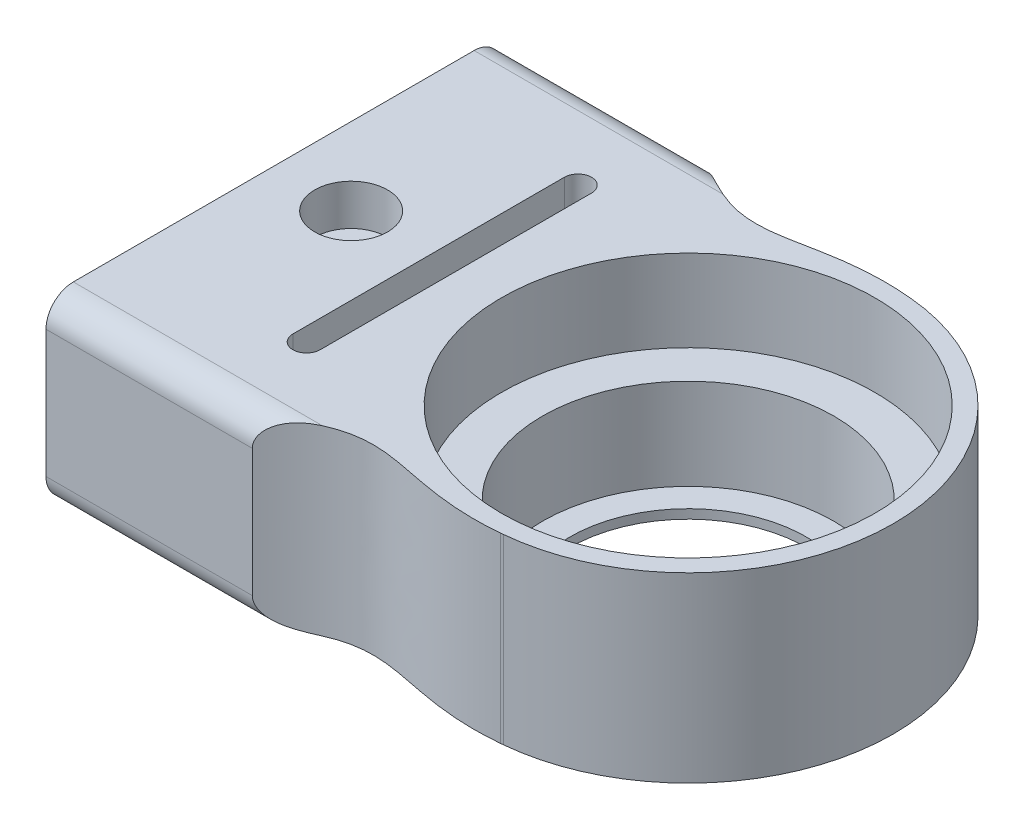
from build123d import *

# Parameters (mm, degrees)
EXTRUDE_1_DEPTH             = 20
SKETCH_2_R                  = 7
CUT_EXTRUDE_1_DEPTH         = 20
SKETCH_3_R                  = 13
CUT_EXTRUDE_2_DEPTH         = 87.740993769
SKETCH_4_R                  = 16
CUT_EXTRUDE_3_DEPTH         = 19
CUT_EXTRUDE_9_DEPTH         = 87.740993769
EXTRUDE_START               = -20
EXTRUDE_4_DEPTH             = 20
FILLET_2_R                  = 3
SKETCH_7_R                  = 20.5
CUT_EXTRUDE_10_DEPTH        = 9
SKETCH_8_W                  = 29.8
SKETCH_8_H                  = 4
CUT_EXTRUDE_11_DEPTH        = 20
CUT_EXTRUDE_12_DEPTH        = 10
HOLE_WIZARD_M41_D           = 4.3
HOLE_WIZARD_M41_DEPTH       = 8
HOLE_WIZARD_M41_CBORE_D     = 8
HOLE_WIZARD_M41_CBORE_DEPTH = 4.5
M4X0_71_D                   = 3.3


# Read off the part's stored shape, not the designer's step: Бобышка-Вытянуть4
with BuildPart() as part:
    # Эскиз1 → Бобышка-Вытянуть1 (new body)
    with BuildSketch(Plane(origin=(0, 0, 0), x_dir=(1, 0, 0), z_dir=(0, 1, 0))):
        with BuildLine():
            Line((0, 0), (0, 50))
            Line((0, 50), (20, 50))
            Line((20, 50), (47.60878471, 47.400960405))
            ThreePointArc((47.60878471, 47.400960405), (68, 25), (47.60878471, 2.599039595))
            Line((47.60878471, 2.599039595), (20, 0))
            Line((20, 0), (0, 0))
        make_face()
    extrude(amount=EXTRUDE_1_DEPTH)

    # Эскиз2 → Вырез-Вытянуть1 (cut)
    with BuildSketch(Plane.ZY):
        with Locations((-39.9, 10)):
            Circle(SKETCH_2_R)
        with Locations(Location((-10.1, 10, 0), (0, 0, 180))):
            Circle(SKETCH_2_R)
    extrude(amount=-CUT_EXTRUDE_1_DEPTH, mode=Mode.SUBTRACT)

    # Эскиз3 → Вырез-Вытянуть2 (cut, through all)
    with BuildSketch(Plane(origin=(0, 20, 0), x_dir=(1, 0, 0), z_dir=(0, 1, 0))):
        with Locations(Location((45.5, 25, 0), (0, 0, 270))):
            Circle(SKETCH_3_R)
    extrude(amount=-CUT_EXTRUDE_2_DEPTH, mode=Mode.SUBTRACT)

    # Эскиз4 → Вырез-Вытянуть3 (cut)
    with BuildSketch(Plane(origin=(0, 20, 0), x_dir=(1, 0, 0), z_dir=(0, 1, 0))):
        with Locations(Location((45.5, 25, 0), (0, 0, 270))):
            Circle(SKETCH_4_R)
    extrude(amount=-CUT_EXTRUDE_3_DEPTH, mode=Mode.SUBTRACT)

    # Эскиз5 → Вырез-Вытянуть9 (cut, through all)
    with BuildSketch(Plane(origin=(0, 20, 0), x_dir=(1, 0, 0), z_dir=(0, 1, 0))):
        with BuildLine():
            add(Edge.make_bspline(
                [(47.32108314, 47.428044097), (47.41641101, 47.41948544), (47.512308925, 47.410461109), (47.60878471, 47.400960405)],
                knots=[0.992066387, 0.992066387, 0.992066387, 0.992066387, 1, 1, 1, 1], degree=3))
            Line((47.32108314, 47.428044095), (47.60878471, 47.400960405))
        make_face()
        with BuildLine():
            Line((47.32108314, 47.428044097), (23, 49.717585585))
            add(Edge.make_bspline(
                [(23, 49.717585585), (32.393861284, 42.286998451), (35.400716473, 48.498269788), (47.32108314, 47.428044097)],
                knots=[0, 0, 0, 0, 0.992066387, 0.992066387, 0.992066387, 0.992066387], degree=3))
        make_face()
        with BuildLine():
            add(Edge.make_bspline(
                [(23, 0.282414415), (32.393861284, 7.713001549), (35.400716473, 1.501730212), (47.32108314, 2.571955903)],
                knots=[0, 0, 0, 0, 0.992066387, 0.992066387, 0.992066387, 0.992066387], degree=3))
            Line((23, 0.282414415), (47.32108314, 2.571955903))
        make_face()
        with BuildLine():
            Line((47.60878471, 2.599039595), (47.32108314, 2.571955905))
            add(Edge.make_bspline(
                [(47.32108314, 2.571955903), (47.41641101, 2.58051456), (47.512308925, 2.589538891), (47.60878471, 2.599039595)],
                knots=[0.992066387, 0.992066387, 0.992066387, 0.992066387, 1, 1, 1, 1], degree=3))
        make_face()
    extrude(amount=-CUT_EXTRUDE_9_DEPTH, mode=Mode.SUBTRACT)

    # Бобышка-Вытянуть4 outline → Бобышка-Вытянуть4 (add)
    with BuildSketch(Plane(origin=(0, 20, 0), x_dir=(1, 0, 0), z_dir=(0, 1, 0)).offset(EXTRUDE_START)):
        with BuildLine():
            add(Edge.make_bspline(
                [(22.6429674, 50), (22.761978267, 49.905861862), (22.880989133, 49.811723723), (23, 49.717585585)],
                knots=[-0.012568493, -0.012568493, -0.012568493, -0.012568493, 0, 0, 0, 0], degree=3))
            Line((22.6429674, 50), (20, 50))
            Line((20, 50), (23, 49.717585585))
        make_face()
        with BuildLine():
            Line((20, 0), (22.6479861, 0))
            add(Edge.make_bspline(
                [(22.6479861, 0), (22.766323231, 0.09625734), (22.883651508, 0.190382227), (23, 0.282414415)],
                knots=[-0.012287325, -0.012287325, -0.012287325, -0.012287325, 0, 0, 0, 0], degree=3))
            Line((23, 0.282414415), (20, 0))
        make_face()
    extrude(amount=EXTRUDE_4_DEPTH)

    # Скругление2
    fillet_2_edges = [part.edges().sort_by_distance(p)[0] for p in [
        (11.32399305, 0, 0),
        (11.32399305, 20, 0),
        (11.3214837, 0, -50),
        (11.3214837, 20, -50),
    ]]
    fillet(fillet_2_edges, radius=FILLET_2_R)

    # Эскиз7 → Вырез-Вытянуть10 (cut)
    with BuildSketch(Plane(origin=(0, 20, 0), x_dir=(1, 0, 0), z_dir=(0, 1, 0))):
        with Locations(Location((45.5, 25, 0), (0, 0, 270))):
            Circle(SKETCH_7_R)
    extrude(amount=-CUT_EXTRUDE_10_DEPTH, mode=Mode.SUBTRACT)

    # Эскиз8 → Вырез-Вытянуть11 (cut)
    with BuildSketch(Plane.ZY):
        with Locations((-25, 10)):
            Rectangle(SKETCH_8_W, SKETCH_8_H)
    extrude(amount=-CUT_EXTRUDE_11_DEPTH, mode=Mode.SUBTRACT)

    # Эскиз9 → Вырез-Вытянуть12 (cut)
    with BuildSketch(Plane(origin=(0, 20, 0), x_dir=(1, 0, 0), z_dir=(0, 1, 0))):
        with BuildLine():
            Line((20, 39.9), (20, 10.1))
            ThreePointArc((20, 10.1), (18.5, 8.6), (17, 10.1))
            Line((17, 10.1), (17, 39.9))
            ThreePointArc((17, 39.9), (18.5, 41.4), (20, 39.9))
        make_face()
    extrude(amount=-CUT_EXTRUDE_12_DEPTH, mode=Mode.SUBTRACT)

    # Цековка для винта с внутренним шестигранником M41
    with Locations(Plane(origin=(0, 20, 0), x_dir=(1, 0, 0), z_dir=(0, 1, 0))):
        with Locations((8.5, 25)):
            CounterBoreHole(HOLE_WIZARD_M41_D / 2, HOLE_WIZARD_M41_CBORE_D / 2, HOLE_WIZARD_M41_CBORE_DEPTH, depth=HOLE_WIZARD_M41_DEPTH)

    # Отверстие обработанное метчиком M4x0.71 (through all)
    with Locations(Plane(origin=(0, 8, 0), x_dir=(1, 0, 0), z_dir=(0, 1, 0))):
        with Locations((8.5, 25)):
            Hole(M4X0_71_D / 2)


solid = part.part
